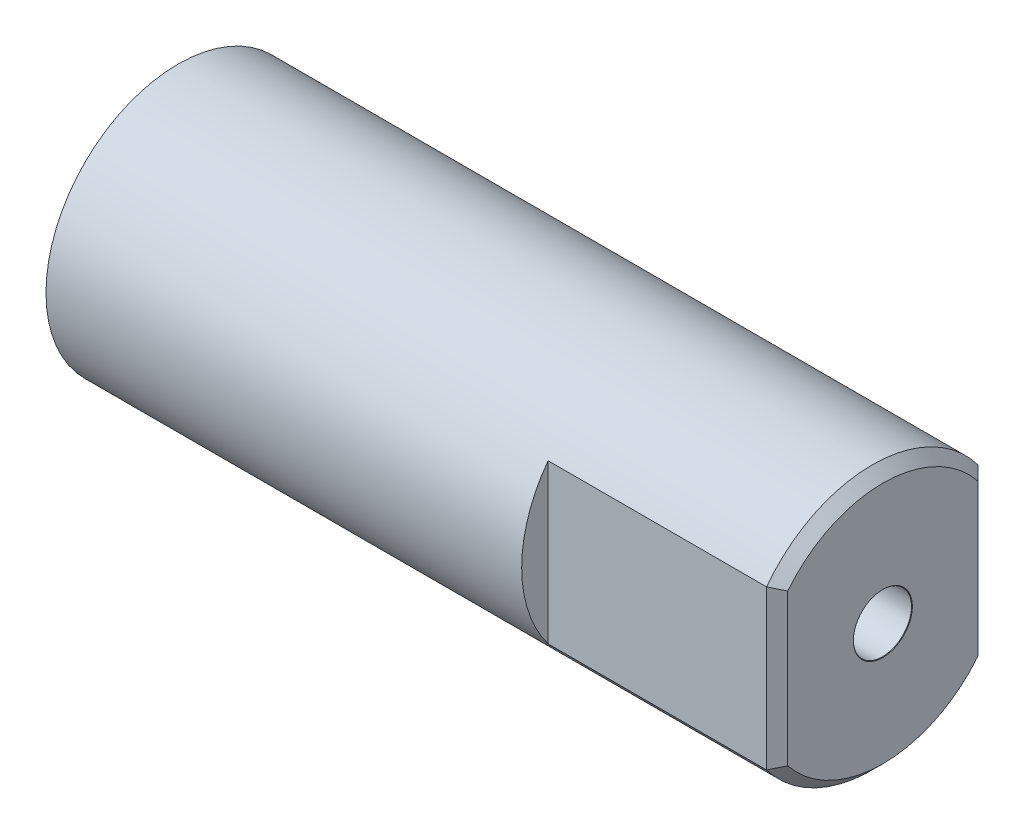
from build123d import *

# Parameters (mm, degrees)
SKETCH1_W                         = 40
SKETCH1_H                         = 7.5
TAP_DRILL_FOR_M4_TAP1_D           = 3.3
TAP_DRILL_FOR_M4_TAP1_DEPTH       = 10
TAP_DRILL_FOR_M4_TAP1_CSINK_D     = 3.35
TAP_DRILL_FOR_M4_TAP1_CSINK_ANGLE = 90
TAP_DRILL_FOR_M4_TAP1_TIP         = 0.991420021
CUT_EXTRUDE1_DEPTH                = 13
CHAMFER1_SIZE                     = 0.6


with BuildPart() as part:
    # Sketch1 → Revolve1 (revolve)
    with BuildSketch(Plane.XY):
        with Locations((20, 3.75)):
            Rectangle(SKETCH1_W, SKETCH1_H)
    revolve(axis=Axis((40, 0, 0), (-1, 0, 0)))

    # Tap Drill for M4 Tap1
    with Locations(Plane(origin=(40, 0, 0), x_dir=(0, 0, -1), z_dir=(1, 0, 0))):
        with Locations((0, 0)):
            CounterSinkHole(TAP_DRILL_FOR_M4_TAP1_D / 2, TAP_DRILL_FOR_M4_TAP1_CSINK_D / 2, depth=TAP_DRILL_FOR_M4_TAP1_DEPTH, counter_sink_angle=TAP_DRILL_FOR_M4_TAP1_CSINK_ANGLE)
            with Locations((0, 0, -(TAP_DRILL_FOR_M4_TAP1_DEPTH + TAP_DRILL_FOR_M4_TAP1_TIP / 2))):  # 118° drill point
                Cone(0, TAP_DRILL_FOR_M4_TAP1_D / 2, TAP_DRILL_FOR_M4_TAP1_TIP, mode=Mode.SUBTRACT)

    # Sketch6 → Cut-Extrude1 (cut)
    with BuildSketch(Plane(origin=(40, 0, 0), x_dir=(0, 0, -1), z_dir=(1, 0, 0))):
        with BuildLine():
            Line((-6, -4.5), (-6, 4.5))
            ThreePointArc((-6, 4.5), (-7.5, 0), (-6, -4.5))
        make_face()
        with BuildLine():
            ThreePointArc((6, -4.5), (7.5, 0), (6, 4.5))
            Line((6, 4.5), (6, -4.5))
        make_face()
    extrude(amount=-CUT_EXTRUDE1_DEPTH, mode=Mode.SUBTRACT)

    # Chamfer1
    chamfer1_edges = [part.edges().sort_by_distance(p)[0] for p in [
        (40, 0, -6),
        (40, 6.708203932, -3.354101966),
        (40, 0, 6),
        (40, -7.5, 0),
    ]]
    chamfer(chamfer1_edges, length=CHAMFER1_SIZE)


solid = part.part
